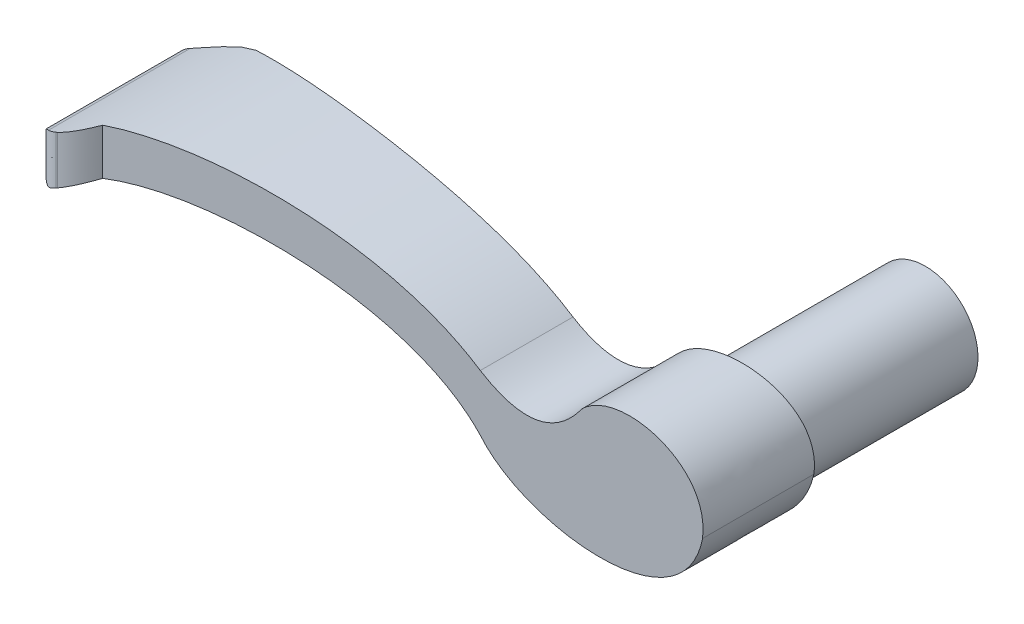
from build123d import *

# Parameters (mm, degrees)
SKETCH_1_W               = 140
SKETCH_1_H               = 40
EXTRUDE_1_DEPTH          = 35
EXTRUDE_2_DEPTH          = 25
SKETCH_3_W               = 140
SKETCH_3_H               = 40
CUT_EXTRUDE_1_DEPTH      = 35
CUT_EXTRUDE_3_DEPTH      = 35
CUT_EXTRUDE_3_DEPTH_BACK = 35
CUT_EXTRUDE_4_DEPTH      = 35
CUT_EXTRUDE_4_DEPTH_BACK = 35
SKETCH_7_R               = 8.5
EXTRUDE_3_DEPTH          = 46
SKETCH_8_R               = 5
CUT_EXTRUDE_5_DEPTH      = 5


# Read off the part's stored shape, not the designer's step: 凸台-拉伸2
with BuildPart() as part:
    # 草图1 → 凸台-拉伸1 (new body)
    with BuildSketch(Plane.XY):
        Rectangle(SKETCH_1_W, SKETCH_1_H)
    extrude(amount=EXTRUDE_1_DEPTH)

    # 凸台-拉伸2 outline → 凸台-拉伸2 (add)
    with BuildSketch(Plane.XY.offset(35)):
        with BuildLine():
            add(Edge.make_bspline(
                [(4.99979571, 5.544461103), (14.93503193, -0.57740686), (21.362876996, 8.324395915)],
                knots=[6.93e-07, 6.93e-07, 6.93e-07, 1, 1, 1], degree=2))
            add(Edge.make_bspline(
                [(-62.204901581, 6.84122677), (-61.92798769, 6.977283921), (-60.294583456, 7.758325304), (-55.702877861, 9.628058542), (-47.815957259, 11.775440787), (-37.533060807, 13.26503558), (-26.917650518, 13.670745136), (-16.380744799, 12.945092857), (-6.360189442, 10.9325016), (0.253451635, 8.349640422), (3.857061157, 6.27680637), (4.666883474, 5.764061136), (4.99979571, 5.544461103)],
                knots=[0.117295231, 0.117295231, 0.117295231, 0.117295231, 0.129103067, 0.186305898, 0.302547913, 0.418789927, 0.535031942, 0.651273956, 0.767515971, 0.883757985, 0.904141366, 0.918671815, 0.918671815, 0.918671815, 0.918671815], degree=3))
            ThreePointArc((-62.204901581, 6.84122677), (-64.244084584, 4.997077414), (-65, 2.353642897))
            Line((-65, 2.353642897), (-65, 0.938055763))
            ThreePointArc((-65, 0.938055763), (-63.904973445, -0.928026304), (-61.741817309, -0.882190007))
            add(Edge.make_bspline(
                [(-61.741817309, -0.882190007), (-54.274901725, 3.714814791), (-28.022038825, 9.247775757), (-1.769175925, 3.780623693), (5, -3.520342201)],
                knots=[0.070063884, 0.070063884, 0.070063884, 0.070063884, 0.5, 1, 1, 1, 1], degree=3))
            add(Edge.make_bspline(
                [(5, -3.520342201), (12.391425527, -12.533975981), (37.865765315, -15.442874495), (40.911305501, 0)],
                knots=[0, 0, 0, 0, 1, 1, 1, 1], degree=3))
            add(Edge.make_bspline(
                [(40.911305501, 0), (41.685623973, 6.326172477), (33.243695942, 12.959768139), (23.757997073, 10.791133007), (21.362876996, 8.324395915)],
                knots=[0.14862794, 0.14862794, 0.14862794, 0.14862794, 0.452578319, 0.661483353, 0.661483353, 0.661483353, 0.661483353], degree=3))
        make_face()
    extrude(amount=EXTRUDE_2_DEPTH)

    # 草图3 → 切除-拉伸1 (cut)
    with BuildSketch(Plane(origin=(0, 0, 0), x_dir=(-1, 0, 0), z_dir=(0, 0, -1))):
        Rectangle(SKETCH_3_W, SKETCH_3_H)
    extrude(amount=-CUT_EXTRUDE_1_DEPTH, mode=Mode.SUBTRACT)

    # 草图4 → 切除-拉伸3 (cut, two sides: drawn at the far end of the back side and taken through both)
    with BuildSketch(Plane(origin=(0, 0, 0), x_dir=(1, 0, 0), z_dir=(0, 1, 0)).offset(-CUT_EXTRUDE_3_DEPTH_BACK)):
        with BuildLine():
            Line((40.990847483, -57), (-56, -57))
            add(Edge.make_bspline(
                [(-60.349653835, -60), (-58.152730496, -59.93219396), (-56, -57)],
                knots=[0.511562339, 0.511562339, 0.511562339, 1, 1, 1], degree=2))
            Line((-60.349653835, -60), (40.990847483, -60))
            Line((40.990847483, -60), (40.990847483, -57))
        make_face()
        with BuildLine():
            Line((-65, -60), (-60.557775934, -60))
            add(Edge.make_bspline(
                [(-65, -57), (-62.756791546, -59.93219396), (-60.557775934, -60)],
                knots=[0, 0, 0, 0.488437661, 0.488437661, 0.488437661], degree=2))
            Line((-65, -57), (-65, -60))
        make_face()
    extrude(amount=CUT_EXTRUDE_3_DEPTH + CUT_EXTRUDE_3_DEPTH_BACK, mode=Mode.SUBTRACT)

    # 草图6 → 切除-拉伸4 (cut, two sides: drawn at the far end of the back side and taken through both)
    with BuildSketch(Plane(origin=(0, 0, 0), x_dir=(1, 0, 0), z_dir=(0, 1, 0)).offset(-CUT_EXTRUDE_4_DEPTH_BACK)):
        with BuildLine():
            Line((40.990847483, -35), (21.362876991, -35))
            Line((21.362876991, -35), (-53.242217102, -35))
            add(Edge.make_bspline(
                [(40.990847483, -39), (-6.258890193, -46.635238136), (-53.242217102, -35)],
                knots=[0, 0, 0, 1, 1, 1], degree=2))
            Line((40.990847483, -39), (40.990847483, -35))
        make_face()
        with BuildLine():
            Line((-65, -36.715937701), (-63.25720797, -36.715937701))
            ThreePointArc((-63.25720797, -36.715937701), (-61.794491028, -36.60838225), (-60.363238722, -36.288029531))
            add(Edge.make_bspline(
                [(-60.363238722, -36.288029531), (-58.81156844, -35.818906777), (-57.248394022, -35.38946773), (-55.674749287, -35)],
                knots=[0.228745815, 0.228745815, 0.228745815, 0.228745815, 1, 1, 1, 1], degree=3))
            Line((-55.674749287, -35), (-65, -35))
            Line((-65, -35), (-65, -36.715937701))
        make_face()
    extrude(amount=CUT_EXTRUDE_4_DEPTH + CUT_EXTRUDE_4_DEPTH_BACK, mode=Mode.SUBTRACT)

    # 草图7 → 凸台-拉伸3 (add)
    with BuildSketch(Plane.XY.offset(57)):
        with Locations((30.911305501, 1.597813248)):
            Circle(SKETCH_7_R)
    extrude(amount=-EXTRUDE_3_DEPTH)

    # 草图8 → 切除-拉伸5 (cut)
    with BuildSketch(Plane(origin=(0, 0, 11), x_dir=(-1, 0, 0), z_dir=(0, 0, -1))):
        with Locations((-30.911305501, 1.597813248)):
            Circle(SKETCH_8_R)
    extrude(amount=-CUT_EXTRUDE_5_DEPTH, mode=Mode.SUBTRACT)


solid = part.part
